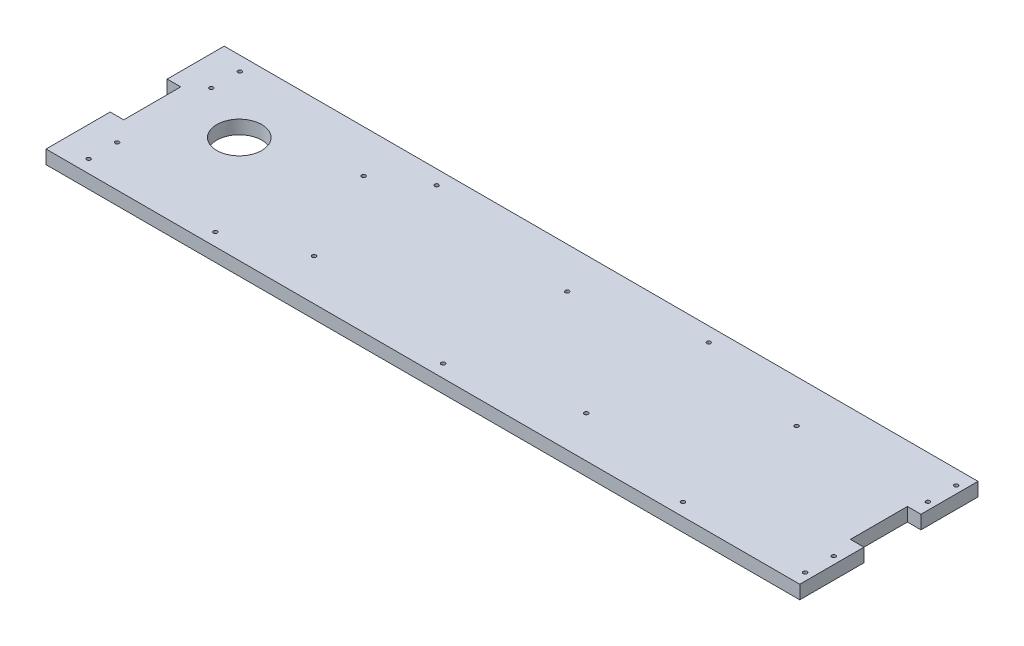
from build123d import *

# Parameters (mm, degrees)
SKETCH1_W                = 1057.441320273
SKETCH1_H                = 19
BOSS_EXTRUDE1_DEPTH      = 250
SKETCH2_R                = 31.573001038
CUT_EXTRUDE1_DEPTH       = 19
SKETCH3_W                = 80
SKETCH3_H                = 19
CUT_EXTRUDE2_DEPTH       = 19
SKETCH4_W                = 80
SKETCH4_H                = 19
CUT_EXTRUDE3_DEPTH       = 19
M5_CLEARANCE_HOLE1_D     = 5.5
M5_CLEARANCE_HOLE1_DEPTH = 19
M5_CLEARANCE_HOLE1_TIP   = 1.652366702


with BuildPart() as part:
    # Sketch1 → Boss-Extrude1 (new body)
    with BuildSketch(Plane.XY):
        with Locations((-1369.179261461, 552.74355083)):
            Rectangle(SKETCH1_W, SKETCH1_H)
    extrude(amount=BOSS_EXTRUDE1_DEPTH)

    # Sketch2 → Cut-Extrude1 (cut)
    with BuildSketch(Plane.XZ.offset(-543.24355083)):
        with Locations((-1776.341518952, 100.455790512)):
            Circle(SKETCH2_R)
    extrude(amount=-CUT_EXTRUDE1_DEPTH, mode=Mode.SUBTRACT)

    # Sketch3 → Cut-Extrude2 (cut)
    with BuildSketch(Plane(origin=(-840.458601324, 0, 0), x_dir=(0, 0, -1), z_dir=(1, 0, 0))):
        with Locations((-120, 552.74355083)):
            Rectangle(SKETCH3_W, SKETCH3_H)
    extrude(amount=-CUT_EXTRUDE2_DEPTH, mode=Mode.SUBTRACT)

    # Sketch4 → Cut-Extrude3 (cut)
    with BuildSketch(Plane.ZY.offset(1897.899921597)):
        with Locations((120, 552.74355083)):
            Rectangle(SKETCH4_W, SKETCH4_H)
    extrude(amount=-CUT_EXTRUDE3_DEPTH, mode=Mode.SUBTRACT)

    # M5 Clearance Hole1
    with Locations(Plane(origin=(-1856.097887447, 562.24355083, 60), x_dir=(0, 0, 1), z_dir=(0, 1, 0))):
        with Locations((0, 0), (-39.987999611, 0.06493393), (132.000000001, 0.066602059), (172.000000001, 0.066602059), (172.000000001, 177.666514089), (132.000000001, 276.230117177), (0, 213.782662103), (-39.908880188, 276.228444982), (-2.45, 496.898095819), (172.000000001, 497.349837951), (132.000000001, 658.103082549), (-39.799475553, 658.10140473), (0, 821.099665774), (172.000000001, 833.780406084), (132.000000001, 1005.317261343), (172.000000001, 1005.192817421), (0, 1005.317261343), (-39.7, 1005.317261343)):
            Hole(M5_CLEARANCE_HOLE1_D / 2, depth=M5_CLEARANCE_HOLE1_DEPTH)
            with Locations((0, 0, -(M5_CLEARANCE_HOLE1_DEPTH + M5_CLEARANCE_HOLE1_TIP / 2))):  # 118° drill point
                Cone(0, M5_CLEARANCE_HOLE1_D / 2, M5_CLEARANCE_HOLE1_TIP, mode=Mode.SUBTRACT)


solid = part.part
